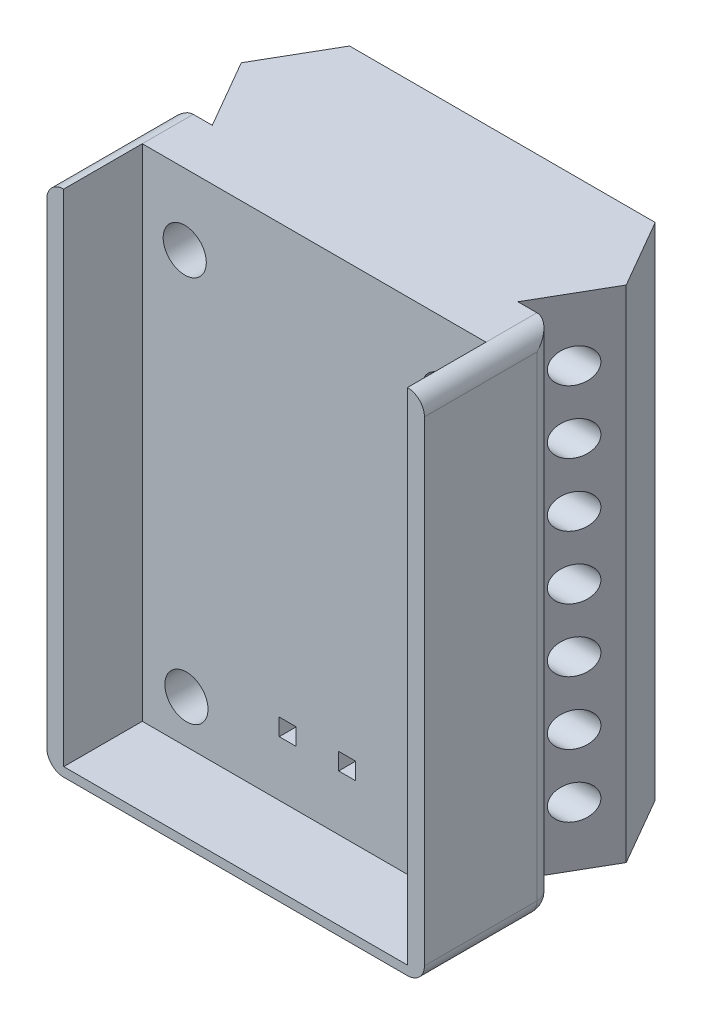
from build123d import *

# Parameters (mm, degrees)
BOSS_EXTRUDE1_DEPTH      = 13
BOSS_EXTRUDE1_DEPTH_BACK = 3
SKETCH1_W                = 22.242116592
SKETCH1_H                = 30
SKETCH4_W                = 20.242116592
SKETCH4_H                = 12
CUT_EXTRUDE1_DEPTH       = 33
SKETCH3_W                = 1
SKETCH3_H                = 1
CUT_EXTRUDE2_DEPTH       = 2.1
SKETCH6_R                = 1.27
CUT_EXTRUDE3_DEPTH       = 3.1
BOSS_EXTRUDE3_DEPTH      = 29.459732878
SKETCH8_R                = 1
CUT_EXTRUDE4_DEPTH       = 39.644200609
LPATTERN1_COUNT          = 7
LPATTERN1_PITCH          = 3.71
FILLET2_R                = 1
OPTIONALCUT_DEPTH        = 39.644200609
OPTIONALCUT_DEPTH_BACK   = 39.644200609
SKETCH9_W                = 34.001532977
SKETCH9_H                = 12.141543576


with BuildPart() as part:
    # Sketch1 → Boss-Extrude1 (new, two sides: drawn at the far end of the back side and taken through both)
    with BuildSketch(Plane.XY.offset(-BOSS_EXTRUDE1_DEPTH_BACK)):
        with Locations((10.030822696, 14.459732878)):
            Rectangle(SKETCH1_W, SKETCH1_H)
    extrude(amount=BOSS_EXTRUDE1_DEPTH + BOSS_EXTRUDE1_DEPTH_BACK)

    # Sketch4 → Cut-Extrude1 (cut)
    with BuildSketch(Plane(origin=(0, 0, 0), x_dir=(1, 0, 0), z_dir=(0, 1, 0))):
        with Locations((10.030822696, -6)):
            Rectangle(SKETCH4_W, SKETCH4_H)
    extrude(amount=CUT_EXTRUDE1_DEPTH, mode=Mode.SUBTRACT)

    # Sketch3 → Cut-Extrude2 (cut)
    with BuildSketch(Plane.XY):
        with Locations((11.976170858, 3.750395558)):
            Rectangle(SKETCH3_W, SKETCH3_H)
        with Locations((8.476170858, 3.750395558)):
            Rectangle(SKETCH3_W, SKETCH3_H)
    extrude(amount=-CUT_EXTRUDE2_DEPTH, mode=Mode.SUBTRACT)

    # Sketch6 → Cut-Extrude3 (cut)
    with BuildSketch(Plane(origin=(0, 0, -3), x_dir=(-1, 0, 0), z_dir=(0, 0, -1))):
        with Locations((-17.651880992, 25.283129292)):
            Circle(SKETCH6_R)
        with Locations((-2.4097644, 25.283129292)):
            Circle(SKETCH6_R)
        with Locations((-17.751880992, 2.54676855)):
            Circle(SKETCH6_R)
        with Locations((-2.5097644, 2.54676855)):
            Circle(SKETCH6_R)
    extrude(amount=-CUT_EXTRUDE3_DEPTH, mode=Mode.SUBTRACT)

    # Sketch7 → Boss-Extrude3 (add)
    with BuildSketch(Plane(origin=(0, 0, 0), x_dir=(1, 0, 0), z_dir=(0, 1, 0))):
        Polygon((1.030822696, 3), (19.030822696, 3), (21.365822696, 7.044338636), (19.030822696, 11.088677271), (1.030822696, 11.088677271), (-1.304177304, 7.044338636), align=None)
    extrude(amount=BOSS_EXTRUDE3_DEPTH)

    # Sketch8 → Cut-Extrude4 (cut, symmetric)
    with BuildSketch(Plane(origin=(0, 0, 0), x_dir=(0, 0, -1), z_dir=(1, 0, 0))):
        with Locations(Location((5.1, 25.749732878, 0), (0, 0, 180))):
            Circle(SKETCH8_R)
    cut_extrude4 = extrude(amount=CUT_EXTRUDE4_DEPTH, both=True, mode=Mode.SUBTRACT)

    # LPattern1: Cut-Extrude4 ×7
    with Locations(*[(0, -i * LPATTERN1_PITCH, 0) for i in range(1, LPATTERN1_COUNT)]):
        add(cut_extrude4, mode=Mode.SUBTRACT)

    # Fillet2
    # the kernel refuses this fillet: 1 mm, written as the material it takes off along each edge
    with BuildSketch(Plane(origin=(20.151880992, 0.459732878, -2), x_dir=(0, 0, -1), z_dir=(1, 0, 0))) as fillet2_piece_1_section:
        Polygon((0, 0), (FILLET2_R * 1.02, 0), (FILLET2_R * 1.02, -FILLET2_R * 1.02), (0, -FILLET2_R * 1.02), align=None)
    fillet2_piece_1 = extrude(amount=FILLET2_R * 1.02, mode=Mode.PRIVATE)
    fillet2_piece_1 = fillet2_piece_1 - Plane(origin=(20.151880992, 0.459732878, -2), x_dir=(0, 0.7071067811865475, 0.7071067811865475), z_dir=(1, 0, 0)) * Sphere(FILLET2_R, mode=Mode.PRIVATE)
    add(fillet2_piece_1, mode=Mode.SUBTRACT)
    with BuildSketch(Plane(origin=(-0.0902356, 0.459732878, -2), x_dir=(0, 0, -1), z_dir=(-1, 0, 0))) as fillet2_piece_2_section:
        Polygon((0, 0), (FILLET2_R * 1.02, 0), (FILLET2_R * 1.02, FILLET2_R * 1.02), (0, FILLET2_R * 1.02), align=None)
    fillet2_piece_2 = extrude(amount=FILLET2_R * 1.02, mode=Mode.PRIVATE)
    fillet2_piece_2 = fillet2_piece_2 - Plane(origin=(-0.0902356, 0.459732878, -2), x_dir=(0, 0.7071067811865475, 0.7071067811865475), z_dir=(-1, 0, 0)) * Sphere(FILLET2_R, mode=Mode.PRIVATE)
    add(fillet2_piece_2, mode=Mode.SUBTRACT)
    with BuildSketch(Plane(origin=(20.151880992, 0.459732878, 12), x_dir=(1, 0, 0), z_dir=(0, 0, 1))) as fillet2_piece_3_section:
        Polygon((0, 0), (FILLET2_R * 1.02, 0), (FILLET2_R * 1.02, -FILLET2_R * 1.02), (0, -FILLET2_R * 1.02), align=None)
    fillet2_piece_3 = extrude(amount=FILLET2_R * 1.02, mode=Mode.PRIVATE)
    fillet2_piece_3 = fillet2_piece_3 - Plane(origin=(20.151880992, 0.459732878, 12), x_dir=(-0.7071067811865476, 0.7071067811865475, 0), z_dir=(0, 0, 1)) * Sphere(FILLET2_R, mode=Mode.PRIVATE)
    add(fillet2_piece_3, mode=Mode.SUBTRACT)
    with BuildSketch(Plane(origin=(-0.0902356, 0.459732878, 12), x_dir=(0, -1, 0), z_dir=(0, 0, 1))) as fillet2_piece_4_section:
        Polygon((0, 0), (FILLET2_R * 1.02, 0), (FILLET2_R * 1.02, -FILLET2_R * 1.02), (0, -FILLET2_R * 1.02), align=None)
    fillet2_piece_4 = extrude(amount=FILLET2_R * 1.02, mode=Mode.PRIVATE)
    fillet2_piece_4 = fillet2_piece_4 - Plane(origin=(-0.0902356, 0.459732878, 12), x_dir=(0.7071067811865475, 0.7071067811865477, 0), z_dir=(0, 0, 1)) * Sphere(FILLET2_R, mode=Mode.PRIVATE)
    add(fillet2_piece_4, mode=Mode.SUBTRACT)
    with BuildSketch(Plane(origin=(-0.0902356, 28.459732878, 12), x_dir=(-1, 0, 0), z_dir=(0, 1, 0))) as fillet2_piece_5_section:
        Polygon((0, 0), (FILLET2_R * 1.02, 0), (FILLET2_R * 1.02, FILLET2_R * 1.02), (0, FILLET2_R * 1.02), align=None)
    fillet2_piece_5 = extrude(amount=FILLET2_R * 1.02, mode=Mode.PRIVATE)
    fillet2_piece_5 = fillet2_piece_5 - Plane(origin=(-0.0902356, 28.459732878, 12), x_dir=(0.7071067811865475, 0, -0.7071067811865475), z_dir=(0, 1, 0)) * Sphere(FILLET2_R, mode=Mode.PRIVATE)
    add(fillet2_piece_5, mode=Mode.SUBTRACT)
    with BuildSketch(Plane(origin=(20.151880992, 28.459732878, 12), x_dir=(0, 0, 1), z_dir=(0, 1, 0))) as fillet2_piece_6_section:
        Polygon((0, 0), (FILLET2_R * 1.02, 0), (FILLET2_R * 1.02, FILLET2_R * 1.02), (0, FILLET2_R * 1.02), align=None)
    fillet2_piece_6 = extrude(amount=FILLET2_R * 1.02, mode=Mode.PRIVATE)
    fillet2_piece_6 = fillet2_piece_6 - Plane(origin=(20.151880992, 28.459732878, 12), x_dir=(-0.7071067811865475, 0, -0.7071067811865475), z_dir=(0, 1, 0)) * Sphere(FILLET2_R, mode=Mode.PRIVATE)
    add(fillet2_piece_6, mode=Mode.SUBTRACT)
    with BuildSketch(Plane(origin=(20.151880992, -0.540267122, -3), x_dir=(0, 1, 0), z_dir=(-1, 0, 0))) as fillet2_piece_7_section:
        with BuildLine():
            CenterArc((FILLET2_R, -FILLET2_R), FILLET2_R, 90, 90)
            Line((0, -FILLET2_R), (0, 0))
            Line((0, 0), (FILLET2_R, 0))
        make_face()
    fillet2_piece_7 = extrude(amount=20.242116592, mode=Mode.PRIVATE)
    fillet2_piece_7 = split(fillet2_piece_7, bisect_by=Plane(origin=(19.153997777, 0.112957923, -3.213345499), z_dir=(0.8660254037844363, 0, 0.5000000000000041)), keep=Keep.TOP, mode=Mode.PRIVATE)
    add(fillet2_piece_7, mode=Mode.SUBTRACT)
    with BuildSketch(Plane(origin=(20.151880992, -0.540267122, -3), x_dir=(0, 1, 0), z_dir=(-1, 0, 0))) as fillet2_piece_8_section:
        with BuildLine():
            CenterArc((FILLET2_R, -FILLET2_R), FILLET2_R, 90, 90)
            Line((0, -FILLET2_R), (0, 0))
            Line((0, 0), (FILLET2_R, 0))
        make_face()
    fillet2_piece_8 = extrude(amount=20.242116592, mode=Mode.PRIVATE)
    fillet2_piece_8 = split(fillet2_piece_8, bisect_by=Plane(origin=(10.030822696, 0, -2.762798919), z_dir=(0, -1, 0)), keep=Keep.TOP, mode=Mode.PRIVATE)
    add(fillet2_piece_8, mode=Mode.SUBTRACT)
    with BuildSketch(Plane(origin=(20.151880992, -0.540267122, -3), x_dir=(0, 1, 0), z_dir=(-1, 0, 0))) as fillet2_piece_9_section:
        with BuildLine():
            CenterArc((FILLET2_R, -FILLET2_R), FILLET2_R, 90, 90)
            Line((0, -FILLET2_R), (0, 0))
            Line((0, 0), (FILLET2_R, 0))
        make_face()
    fillet2_piece_9 = extrude(amount=20.242116592, mode=Mode.PRIVATE)
    fillet2_piece_9 = split(fillet2_piece_9, bisect_by=Plane(origin=(0.907647615, 0.112957923, -3.213345499), z_dir=(-0.8660254037844362, 0, 0.5000000000000044)), keep=Keep.TOP, mode=Mode.PRIVATE)
    add(fillet2_piece_9, mode=Mode.SUBTRACT)
    with BuildSketch(Plane(origin=(20.151880992, -0.540267122, 13), x_dir=(0, 1, 0), z_dir=(-1, 0, 0))) as fillet2_piece_10:
        with BuildLine():
            CenterArc((FILLET2_R, FILLET2_R), FILLET2_R, 180, 90)
            Line((0, FILLET2_R), (0, 0))
            Line((0, 0), (FILLET2_R, 0))
        make_face()
    extrude(amount=20.242116592, mode=Mode.SUBTRACT)
    with BuildSketch(Plane(origin=(-1.0902356, 0.459732878, -3), x_dir=(1, 0, 0), z_dir=(0, 1, 0))) as fillet2_piece_11:
        with BuildLine():
            CenterArc((FILLET2_R, -FILLET2_R), FILLET2_R, 90, 90)
            Line((0, -FILLET2_R), (0, 0))
            Line((0, 0), (FILLET2_R, 0))
        make_face()
    extrude(amount=31.5, mode=Mode.SUBTRACT)
    with BuildSketch(Plane(origin=(-1.0902356, 29.459732878, -5.5), x_dir=(1, 0, 0), z_dir=(0, 0, 1))) as fillet2_piece_12_section:
        with BuildLine():
            CenterArc((FILLET2_R, -FILLET2_R), FILLET2_R, 90, 90)
            Line((0, -FILLET2_R), (0, 0))
            Line((0, 0), (FILLET2_R, 0))
        make_face()
    fillet2_piece_12 = extrude(amount=17.5, mode=Mode.PRIVATE)
    fillet2_piece_12 = split(fillet2_piece_12, bisect_by=Plane(origin=(1.20591916, 29.236364939, -2.696724029), z_dir=(-0.8660254037844362, 0, 0.5000000000000044)), keep=Keep.TOP, mode=Mode.PRIVATE)
    add(fillet2_piece_12, mode=Mode.SUBTRACT)
    with BuildSketch(Plane(origin=(-1.0902356, 0.459732878, 13), x_dir=(1, 0, 0), z_dir=(0, 1, 0)), Plane(origin=(21.151880992, 28.459732878, 13), x_dir=(-1, 0, 0), z_dir=(0, -1, 0))) as fillet2_piece_13:
        with BuildLine():
            CenterArc((FILLET2_R, FILLET2_R), FILLET2_R, 180, 90)
            Line((0, FILLET2_R), (0, 0))
            Line((0, 0), (FILLET2_R, 0))
        make_face()
    extrude(amount=28, mode=Mode.SUBTRACT)
    with BuildSketch(Plane(origin=(-1.0902356, -0.540267122, -2), x_dir=(0, 1, 0), z_dir=(0, 0, 1)), Plane(origin=(21.151880992, -0.540267122, 12), x_dir=(0, 1, 0), z_dir=(0, 0, -1))) as fillet2_piece_14:
        with BuildLine():
            CenterArc((FILLET2_R, -FILLET2_R), FILLET2_R, 90, 90)
            Line((0, -FILLET2_R), (0, 0))
            Line((0, 0), (FILLET2_R, 0))
        make_face()
    extrude(amount=14, mode=Mode.SUBTRACT)
    with BuildSketch(Plane(origin=(21.151880992, 31.959732878, -3), x_dir=(0, 0, 1), z_dir=(0, -1, 0))) as fillet2_piece_15:
        with BuildLine():
            CenterArc((FILLET2_R, FILLET2_R), FILLET2_R, 180, 90)
            Line((0, FILLET2_R), (0, 0))
            Line((0, 0), (FILLET2_R, 0))
        make_face()
    extrude(amount=31.5, mode=Mode.SUBTRACT)
    with BuildSketch(Plane(origin=(21.151880992, 29.459732878, 12), x_dir=(-1, 0, 0), z_dir=(0, 0, -1))) as fillet2_piece_16_section:
        with BuildLine():
            CenterArc((FILLET2_R, -FILLET2_R), FILLET2_R, 90, 90)
            Line((0, -FILLET2_R), (0, 0))
            Line((0, 0), (FILLET2_R, 0))
        make_face()
    fillet2_piece_16 = extrude(amount=17.5, mode=Mode.PRIVATE)
    fillet2_piece_16 = split(fillet2_piece_16, bisect_by=Plane(origin=(15.608130968, 29.236364939, 2.928275971), z_dir=(0.8660254037844363, 0, 0.5000000000000041)), keep=Keep.TOP, mode=Mode.PRIVATE)
    add(fillet2_piece_16, mode=Mode.SUBTRACT)
    with BuildSketch(Plane(origin=(-0.0902356, 29.459732878, 13), x_dir=(0, 0, -1), z_dir=(1, 0, 0))) as fillet2_piece_17:
        with BuildLine():
            CenterArc((FILLET2_R, -FILLET2_R), FILLET2_R, 90, 90)
            Line((0, -FILLET2_R), (0, 0))
            Line((0, 0), (FILLET2_R, 0))
        make_face()
    extrude(amount=20.242116592, mode=Mode.SUBTRACT)

    # Sketch9 → OptionalCut (cut, two sides: drawn at the far end of the back side and taken through both)
    with BuildSketch(Plane(origin=(0, 0, 0), x_dir=(1, 0, 0), z_dir=(0, 1, 0)).offset(-OPTIONALCUT_DEPTH_BACK)):
        with Locations((10.877994957, -10.695825978)):
            Rectangle(SKETCH9_W, SKETCH9_H)
    extrude(amount=OPTIONALCUT_DEPTH + OPTIONALCUT_DEPTH_BACK, mode=Mode.SUBTRACT)


solid = part.part
